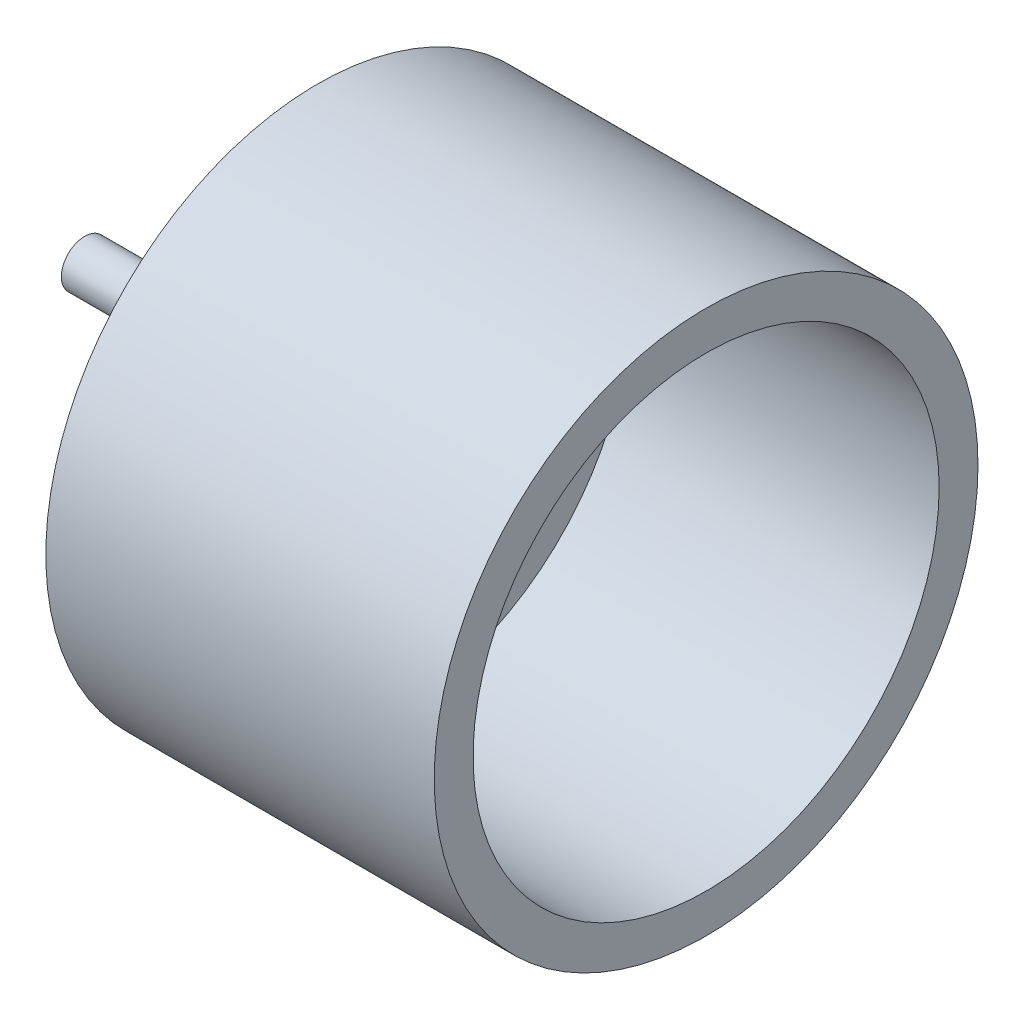
from build123d import *

# Parameters (mm, degrees)
SKETCH1_R                = 17.5
SKETCH1_R_2              = 15
BOSS_EXTRUDE1_DEPTH      = 25
SKETCH1_3_R              = 15
SKETCH1_3_R_2            = 1.5
BOSS_EXTRUDE2_DEPTH      = 5
BOSS_EXTRUDE3_DEPTH      = 5
BOSS_EXTRUDE3_DEPTH_BACK = 15
SKETCH1_4_R              = 1.5


with BuildPart() as part:
    # Sketch1 → Boss-Extrude1 (new body)
    with BuildSketch(Plane(origin=(0, 0, 0), x_dir=(0, 0, -1), z_dir=(1, 0, 0))):
        Circle(SKETCH1_R)
        Circle(SKETCH1_R_2, mode=Mode.SUBTRACT)
    extrude(amount=BOSS_EXTRUDE1_DEPTH)

    # Sketch1<3> → Boss-Extrude2 (add)
    with BuildSketch(Plane(origin=(0, 0, 0), x_dir=(0, 0, -1), z_dir=(1, 0, 0))):
        Circle(SKETCH1_3_R)
        Circle(SKETCH1_3_R_2, mode=Mode.SUBTRACT)
    extrude(amount=BOSS_EXTRUDE2_DEPTH)

    # Sketch1<4> → Boss-Extrude3 (add, two sides: drawn at the far end of the back side and taken through both)
    with BuildSketch(Plane(origin=(0, 0, 0), x_dir=(0, 0, -1), z_dir=(1, 0, 0)).offset(-BOSS_EXTRUDE3_DEPTH_BACK)):
        Circle(SKETCH1_4_R)
    extrude(amount=BOSS_EXTRUDE3_DEPTH + BOSS_EXTRUDE3_DEPTH_BACK)


solid = part.part
